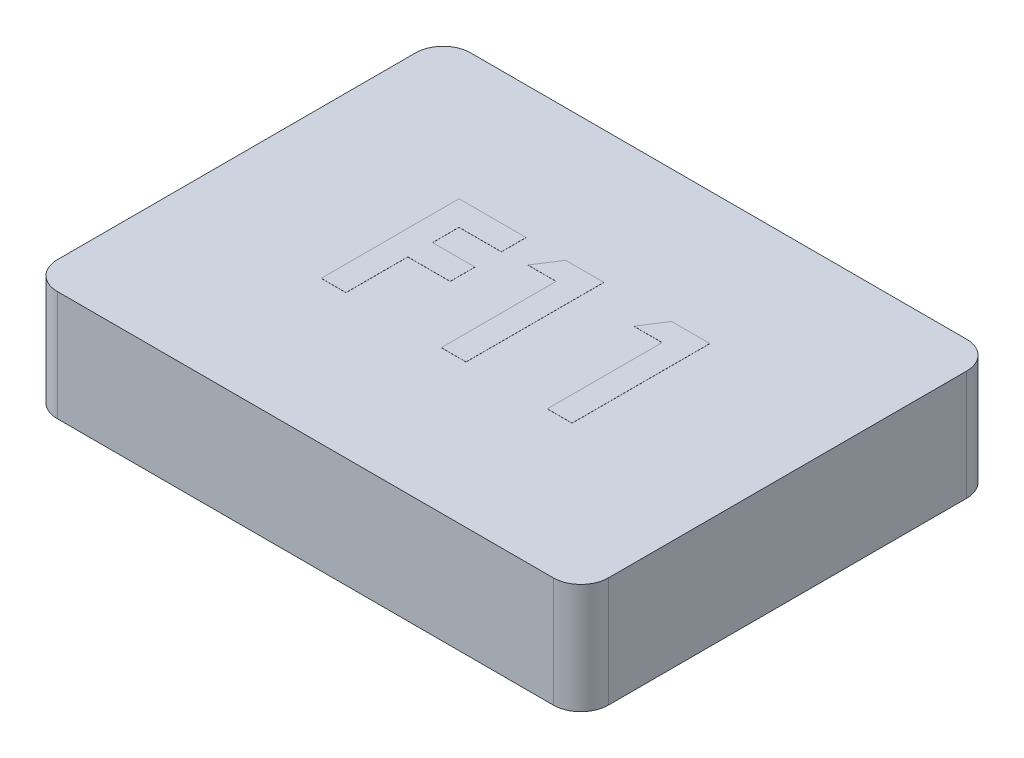
from build123d import *

# Parameters (mm, degrees)
SKETCH1_W           = 12.7
SKETCH1_H           = 9.525
BOSS_EXTRUDE1_DEPTH = 2.54
FILLET1_R           = 0.635
SHELL1_START        = 0.635
SHELL1_OUTLINE_W    = 1.905
SHELL1_OUTLINE_H    = 8.255
SHELL1_DEPTH        = 11.43
SKETCH2_R           = 2.54
BOSS_EXTRUDE2_DEPTH = 1.905
BOSS_EXTRUDE3_DEPTH = 0.00254


# Read off the part's stored shape, not the designer's step: Shell1
with BuildPart() as part:
    # Sketch1 → Boss-Extrude1 (new body)
    with BuildSketch(Plane(origin=(0, 0, 0), x_dir=(1, 0, 0), z_dir=(0, 1, 0))):
        with Locations((6.35, 4.7625)):
            Rectangle(SKETCH1_W, SKETCH1_H)
    extrude(amount=BOSS_EXTRUDE1_DEPTH)

    # Fillet1
    fillet1_edges = [part.edges().sort_by_distance(p)[0] for p in [
        (0, 1.27, -9.525),
        (12.7, 1.27, -9.525),
        (12.7, 1.27, 0),
        (0, 1.27, 0),
    ]]
    fillet(fillet1_edges, radius=FILLET1_R)

    # Shell1 outline → Shell1 (cut)
    with BuildSketch(Plane.YZ.offset(SHELL1_START)):
        with Locations((0.9525, -4.7625)):
            Rectangle(SHELL1_OUTLINE_W, SHELL1_OUTLINE_H)
    extrude(amount=SHELL1_DEPTH, mode=Mode.SUBTRACT)

    # Sketch2 → Boss-Extrude2 (add)
    with BuildSketch(Plane(origin=(0, 1.905, 0), x_dir=(-1, 0, 0), z_dir=(0, -1, 0))):
        with Locations(Location((-6.35, 4.7625, 0), (0, 0, 270))):
            Circle(SKETCH2_R)
    extrude(amount=BOSS_EXTRUDE2_DEPTH)

    # Sketch3 → Boss-Extrude3 (add)
    with BuildSketch(Plane(origin=(0, 2.54, 0), x_dir=(1, 0, 0), z_dir=(0, 1, 0))):
        Polygon((3.414346154, 6.477), (4.961141026, 6.477), (4.961141026, 5.907128205), (3.984217949, 5.907128205), (3.984217949, 5.296551282), (4.961141026, 5.296551282), (4.961141026, 4.726679487), (3.984217949, 4.726679487), (3.984217949, 3.302), (3.414346154, 3.302), align=None)
        Polygon((5.871282252, 6.477), (6.752166667, 6.477), (6.752166667, 3.302), (6.182294872, 3.302), (6.182294872, 5.947833333), (5.531012821, 5.947833333), align=None)
        Polygon((8.313589944, 6.477), (9.194474359, 6.477), (9.194474359, 3.302), (8.624602564, 3.302), (8.624602564, 5.947833333), (7.973320513, 5.947833333), align=None)
    extrude(amount=BOSS_EXTRUDE3_DEPTH)


solid = part.part
